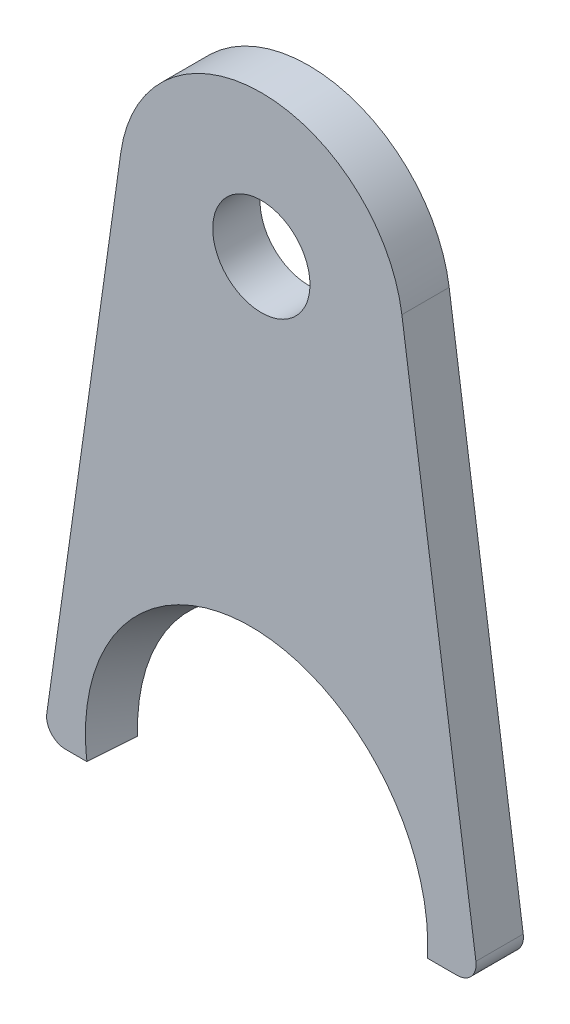
from build123d import *

# Parameters (mm, degrees)
SKETCH1_R           = 3.2639
BOSS_EXTRUDE1_DEPTH = 3.175
CAVITY1_OUTLINE_W   = 11.43
CAVITY1_OUTLINE_H   = 8.831388176
FILLET3_R           = 1.27


# Read off the part's stored shape, not the designer's step: Cavity1
with BuildPart() as part:
    # Sketch1 → Boss-Extrude1 (new body)
    with BuildSketch(Plane.XY):
        with BuildLine():
            ThreePointArc((9.430957534, 1.335164779), (0, 9.525), (-9.430957534, 1.335164779))
            Line((-9.430957534, 1.335164779), (-14.605, -35.211766))
            Line((-14.605, -35.211766), (14.605, -35.211766))
            Line((14.605, -35.211766), (9.430957534, 1.335164779))
        make_face()
        Circle(SKETCH1_R, mode=Mode.SUBTRACT)
    extrude(amount=BOSS_EXTRUDE1_DEPTH)

    # Cavity1 outline → Cavity1 (revolve, cut)
    with BuildSketch(Plane(origin=(-1.130247142, -31.06550514, 11.268870294), x_dir=(0.995594734936216, 0.03225653994771549, 0.08803771576936452), z_dir=(0, 0.9389588693345029, -0.34402941981474794))):
        with Locations((5.715, 8.721306361)):
            Rectangle(CAVITY1_OUTLINE_W, CAVITY1_OUTLINE_H)
    revolve(axis=Axis((-1.130247142, -31.06550514, 11.268870294), (0.09376099278103864, -0.34251387903072417, -0.9348225066310935)), mode=Mode.SUBTRACT)

    # Fillet3
    fillet3_edges = [part.edges().sort_by_distance(p)[0] for p in [
        (-14.605, -35.211766, 1.5875),
        (14.605, -35.211766, 1.5875),
    ]]
    fillet(fillet3_edges, radius=FILLET3_R)


solid = part.part
